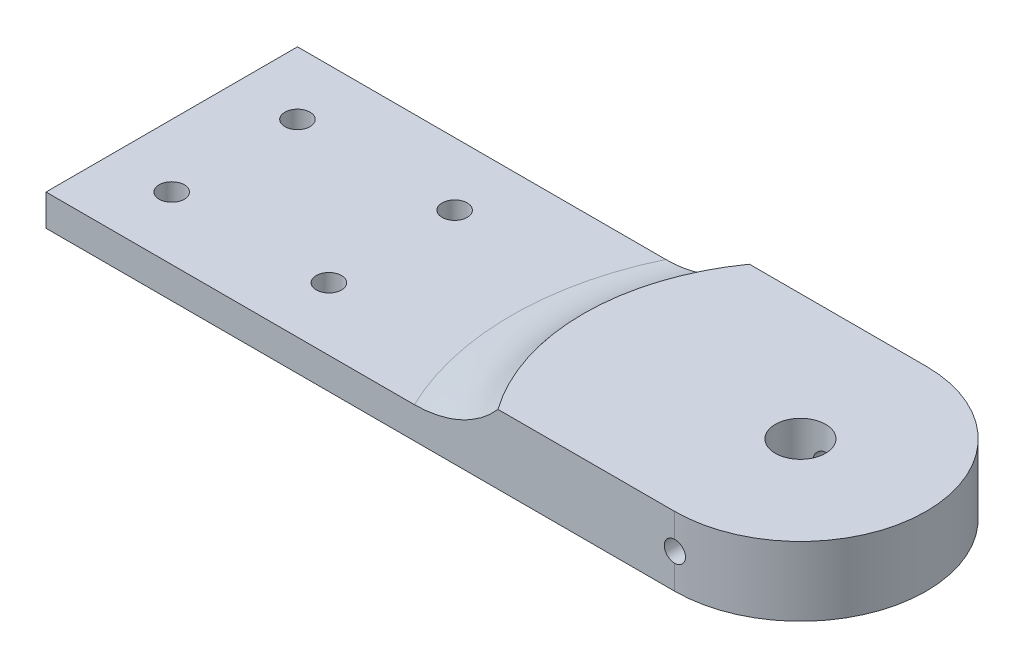
from build123d import *

# Parameters (mm, degrees)
SKETCH1_R           = 2
SKETCH1_R_2         = 4
BOSS_EXTRUDE1_DEPTH = 11
CUT_EXTRUDE1_DEPTH  = 6
FILLET2_R           = 14
M4_TAPPED_HOLE1_D   = 3.3


with BuildPart() as part:
    # Sketch1 → Boss-Extrude1 (new body)
    with BuildSketch(Plane(origin=(0, 0, 0), x_dir=(1, 0, 0), z_dir=(0, 1, 0))):
        with BuildLine():
            Line((0, 20), (-100, 20))
            Line((-100, 20), (-100, -5))
            Line((-100, -5), (-100, -20))
            Line((-100, -20), (0, -20))
            ThreePointArc((0, -20), (14.142135607, -14.14213564), (20, -4.7e-08))
            ThreePointArc((20, -4.7e-08), (14.14213564, 14.142135607), (0, 20))
        make_face()
        with Locations(Location((-90, -10, 0), (0, 0, 270))):
            Circle(SKETCH1_R, mode=Mode.SUBTRACT)
        with Locations(Location((-65, -10, 0), (0, 0, 270))):
            Circle(SKETCH1_R, mode=Mode.SUBTRACT)
        with Locations(Location((-90, 10, 0), (0, 0, 270))):
            Circle(SKETCH1_R, mode=Mode.SUBTRACT)
        with Locations(Location((-65, 10, 0), (0, 0, 270))):
            Circle(SKETCH1_R, mode=Mode.SUBTRACT)
        with Locations(Location((0, 0, 0), (0, 0, 270))):
            Circle(SKETCH1_R_2, mode=Mode.SUBTRACT)
    extrude(amount=BOSS_EXTRUDE1_DEPTH)

    # Sketch4 → Cut-Extrude1 (cut)
    with BuildSketch(Plane(origin=(0, 11, 0), x_dir=(1, 0, 0), z_dir=(0, 1, 0))):
        with BuildLine():
            Line((-28.111385594, 20), (-100, 20))
            Line((-100, 20), (-100, -20))
            Line((-100, -20), (-28.111385594, -20))
            ThreePointArc((-28.111385594, -20), (-34.5, 0), (-28.111385594, 20))
        make_face()
    extrude(amount=-CUT_EXTRUDE1_DEPTH, mode=Mode.SUBTRACT)

    # Fillet2
    # the kernel refuses this fillet: 14 mm, written as the material it adds along each edge
    with BuildSketch(Plane(origin=(0, 5, 0), x_dir=(-0.1193853688936188, 0, 0.9928479912323611), z_dir=(0.9928479912323611, 0, 0.1193853688936188))) as fillet2_piece_1_section:
        with BuildLine():
            CenterArc((45.989125293, -14), FILLET2_R, 90, 55.150095421)
            Line((34.5, -6), (34.270217494, -5.84))
            ThreePointArc((34.270217494, -5.84), (34.22, -3), (34.22, 0))
            Line((34.22, 0), (34.5, 0.28))
            Line((34.5, 0.28), (45.989125293, 0.28))
            Line((45.989125293, 0.28), (45.989125293, 0))
        make_face()
    fillet2_piece_1 = revolve(axis=Axis((0, 5, 0), (0, -1, 0)), revolution_arc=166.286736379, mode=Mode.PRIVATE)
    fillet2_piece_1 = split(fillet2_piece_1, bisect_by=Plane(origin=(-35.442796837, 6.550585525, -20), z_dir=(0, 0, 1)), keep=Keep.TOP, mode=Mode.PRIVATE)
    fillet2_piece_1 = split(fillet2_piece_1, bisect_by=Plane(origin=(-35.442796837, 6.550585525, 20), z_dir=(0, 0, -1)), keep=Keep.TOP, mode=Mode.PRIVATE)
    add(fillet2_piece_1)

    # M4 Tapped Hole1 (through all)
    with Locations(Plane(origin=(0, 0, -20), x_dir=(-1, 0, 0), z_dir=(0, 0, -1))):
        with Locations((0, 5.5)):
            Hole(M4_TAPPED_HOLE1_D / 2)


solid = part.part
